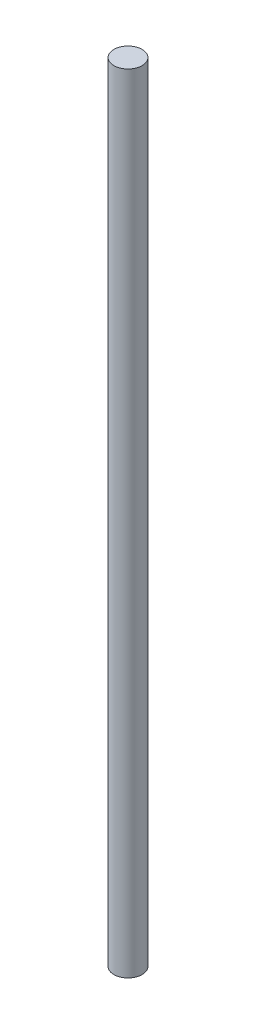
from build123d import *

# Parameters (mm, degrees)
SKETCH1_R           = 5
BOSS_EXTRUDE1_DEPTH = 279.4


with BuildPart() as part:
    # Sketch1 → Boss-Extrude1 (new body)
    with BuildSketch(Plane(origin=(0, 0, 0), x_dir=(1, 0, 0), z_dir=(0, 1, 0))):
        Circle(SKETCH1_R)
    extrude(amount=BOSS_EXTRUDE1_DEPTH)


solid = part.part
